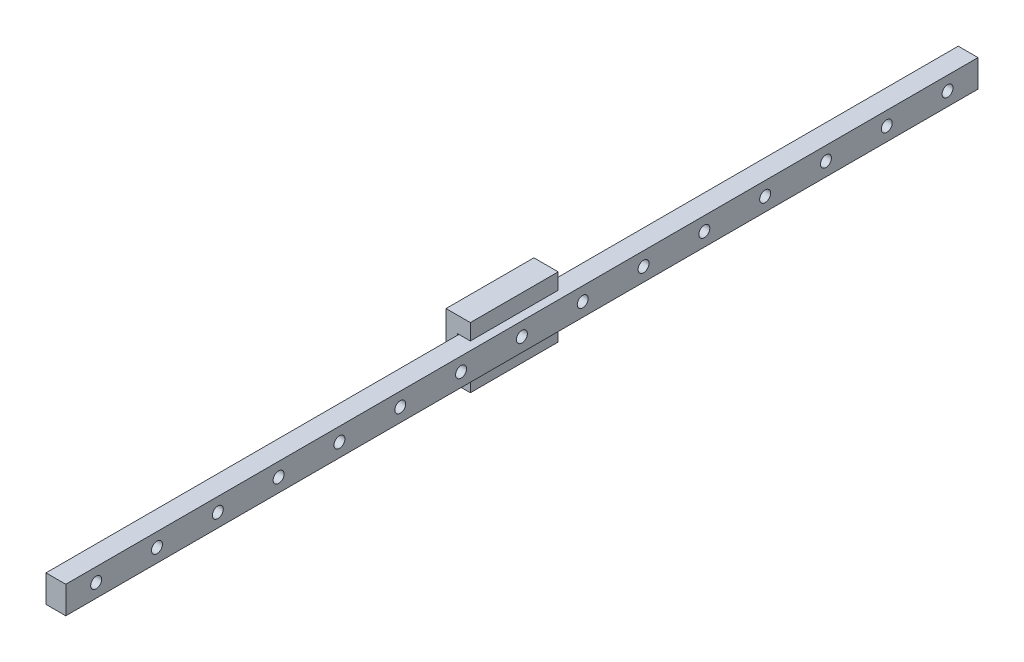
from build123d import *

# Parameters (mm, degrees)
SKETCH1_W                      = 6.5
SKETCH1_H                      = 9
BOSS_EXTRUDE1_DEPTH            = 150
BOSS_EXTRUDE2_DEPTH            = 14.45
M3X0_5_TAPPED_HOLE1_AT_2_COUNT = 2
M3X0_5_TAPPED_HOLE1_AT_2_PITCH = 18.027756377
M3X0_5_TAPPED_HOLE1_AT_3_COUNT = 2
M3X0_5_TAPPED_HOLE1_AT_3_PITCH = 15
M3X0_5_TAPPED_HOLE1_AT_4_COUNT = 2
M3X0_5_TAPPED_HOLE1_AT_4_PITCH = 10
LPATTERN1_COUNT                = 15
LPATTERN1_PITCH                = 20


with BuildPart() as part:
    # Sketch1 → Boss-Extrude1 (new, symmetric)
    with BuildSketch(Plane.XY):
        Rectangle(SKETCH1_W, SKETCH1_H)
    extrude(amount=BOSS_EXTRUDE1_DEPTH, both=True)

    # Sketch6 → CBORE for M3 SHCS1 (revolve, cut)
    with BuildSketch(Plane(origin=(-3.25, 0, -140), x_dir=(0, 0, 1), z_dir=(0, 1, 0))):
        Polygon((0, 0), (0, 6.5), (1.8, 6.5), (1.8, 3), (3.25, 3), (3.25, 0), align=None)
    cbore_for_m3_shcs1 = revolve(axis=Axis((-9.6, 0, -140), (1, 0, 0)), mode=Mode.SUBTRACT)

    # LPattern1: CBORE for M3 SHCS1 ×15
    with Locations(*[(0, 0, i * LPATTERN1_PITCH) for i in range(1, LPATTERN1_COUNT)]):
        add(cbore_for_m3_shcs1, mode=Mode.SUBTRACT)


with BuildPart() as body_2:
    # Sketch2 → Boss-Extrude2 (new, symmetric)
    with BuildSketch(Plane.XY):
        Polygon((0.75, 4.75), (0.75, 10), (-7.25, 10), (-7.25, -10), (0.75, -10), (0.75, -4.75), (-3.45, -4.75), (-3.45, 4.75), align=None)
    extrude(amount=BOSS_EXTRUDE2_DEPTH, both=True)

    # Sketch4 → M3x0.5 Tapped Hole1 (revolve, cut)
    with BuildSketch(Plane(origin=(-7.25, 7.5, -5), x_dir=(0, 0, 1), z_dir=(0, 1, 0))):
        Polygon((0, 0), (0, 3.751075774), (1.25, 3), (1.25, 0), align=None)
    m3x0_5_tapped_hole1 = revolve(axis=Axis((-13.6, 7.5, -5), (1, 0, 0)), mode=Mode.SUBTRACT)

    # M3x0.5 Tapped Hole1 at 2: M3x0.5 Tapped Hole1 ×2
    with Locations(*[Vector(0, -0.8320502943378437, 0.5547001962252291) * (i * M3X0_5_TAPPED_HOLE1_AT_2_PITCH) for i in range(1, M3X0_5_TAPPED_HOLE1_AT_2_COUNT)]):
        add(m3x0_5_tapped_hole1, mode=Mode.SUBTRACT)

    # M3x0.5 Tapped Hole1 at 3: M3x0.5 Tapped Hole1 ×2
    with Locations(*[(0, -i * M3X0_5_TAPPED_HOLE1_AT_3_PITCH, 0) for i in range(1, M3X0_5_TAPPED_HOLE1_AT_3_COUNT)]):
        add(m3x0_5_tapped_hole1, mode=Mode.SUBTRACT)

    # M3x0.5 Tapped Hole1 at 4: M3x0.5 Tapped Hole1 ×2
    with Locations(*[(0, 0, i * M3X0_5_TAPPED_HOLE1_AT_4_PITCH) for i in range(1, M3X0_5_TAPPED_HOLE1_AT_4_COUNT)]):
        add(m3x0_5_tapped_hole1, mode=Mode.SUBTRACT)


solid = Compound([part.part, body_2.part])
